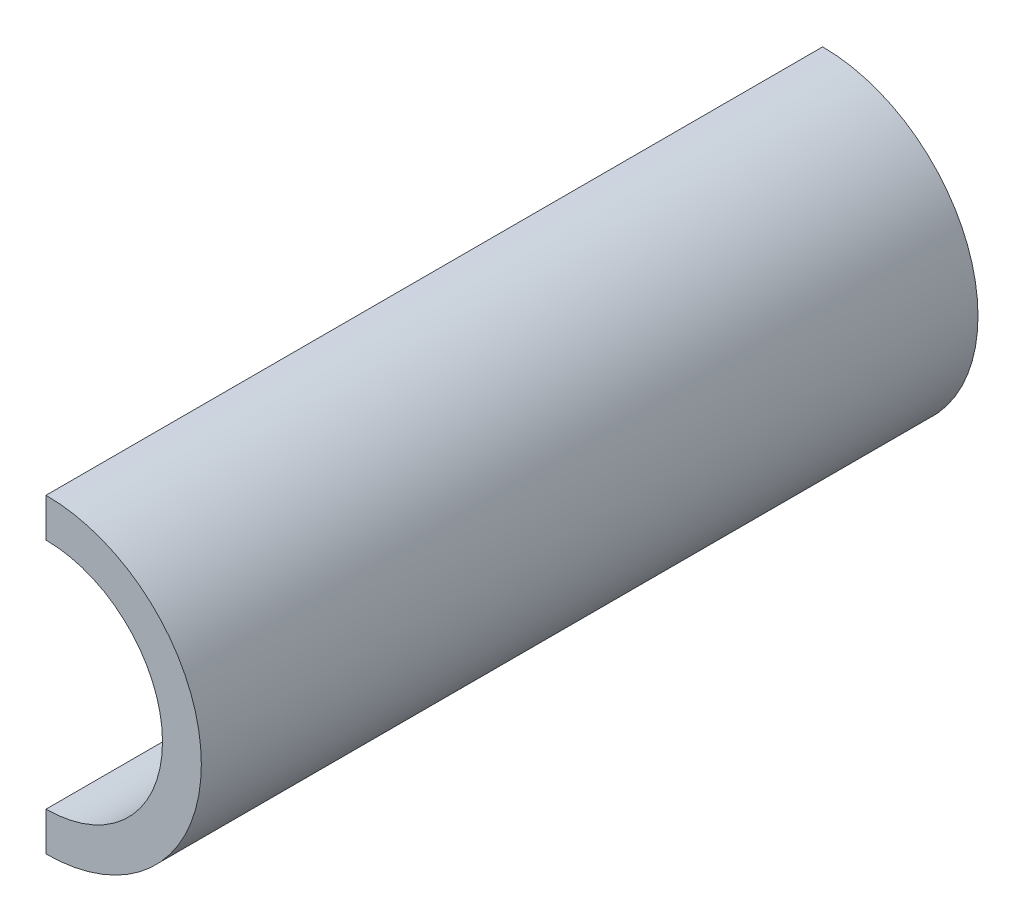
from build123d import *

# Parameters (mm, degrees)
AUFSATZ_LINEAR_AUSTRAGEN1_DEPTH = 100


with BuildPart() as part:
    # Skizze1 → Aufsatz-Linear austragen1 (new, symmetric)
    with BuildSketch(Plane.XY):
        with BuildLine():
            Line((0, 40), (0, 30))
            ThreePointArc((0, 30), (30, 0), (0, -30))
            Line((0, -30), (0, -40))
            ThreePointArc((0, -40), (40, 0), (0, 40))
        make_face()
    extrude(amount=AUFSATZ_LINEAR_AUSTRAGEN1_DEPTH, both=True)


solid = part.part
